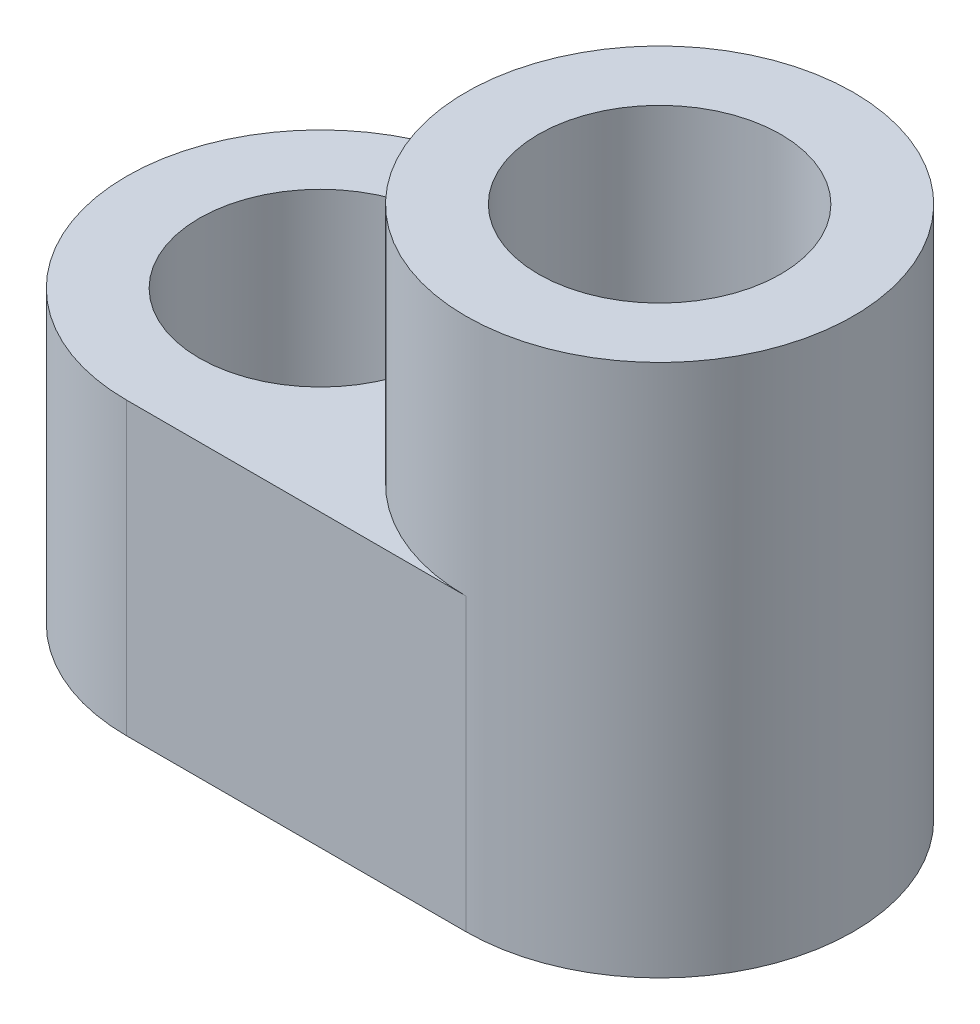
from build123d import *

# Parameters (mm, degrees)
SKETCH1_W           = 15
SKETCH1_H           = 8
SKETCH1_R           = 2.5
BOSS_EXTRUDE1_DEPTH = 6
FILLET1_R           = 4
SKETCH2_R           = 4
BOSS_EXTRUDE2_DEPTH = 5
SKETCH4_R           = 2.5
CUT_EXTRUDE1_DEPTH  = 25


with BuildPart() as part:
    # Sketch1 → Boss-Extrude1 (new body)
    with BuildSketch(Plane(origin=(0, 0, 0), x_dir=(1, 0, 0), z_dir=(0, 1, 0))):
        Rectangle(SKETCH1_W, SKETCH1_H)
        with Locations(Location((-3.5, 0, 0), (0, 0, 270))):
            Circle(SKETCH1_R, mode=Mode.SUBTRACT)
        with Locations(Location((3.5, 0, 0), (0, 0, 270))):
            Circle(SKETCH1_R, mode=Mode.SUBTRACT)
    extrude(amount=BOSS_EXTRUDE1_DEPTH)

    # Fillet1
    fillet1_edges = [part.edges().sort_by_distance(p)[0] for p in [
        (-7.5, 3, -4),
        (7.5, 3, -4),
        (7.5, 3, 4),
        (-7.5, 3, 4),
    ]]
    fillet(fillet1_edges, radius=FILLET1_R - 0.0001)  # a hair under: the kernel refuses the full size

    # Sketch2 → Boss-Extrude2 (add)
    with BuildSketch(Plane(origin=(0, 6, 0), x_dir=(1, 0, 0), z_dir=(0, 1, 0))):
        with Locations(Location((3.5, 0, 0), (0, 0, 270))):
            Circle(SKETCH2_R)
    extrude(amount=BOSS_EXTRUDE2_DEPTH)

    # Sketch4 → Cut-Extrude1 (cut)
    with BuildSketch(Plane.XZ.offset(-6)):
        with Locations(Location((3.5, 0, 0), (0, 0, 90))):
            Circle(SKETCH4_R)
    extrude(amount=-CUT_EXTRUDE1_DEPTH, mode=Mode.SUBTRACT)


solid = part.part
